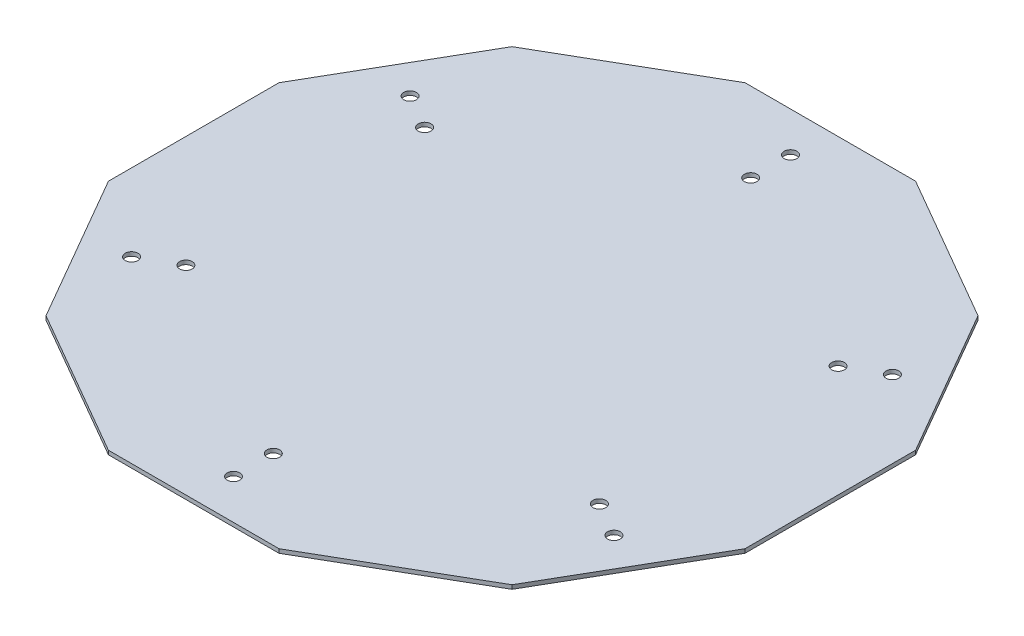
from build123d import *

# Parameters (mm, degrees)
EXTRUDE_2_DEPTH      = 1
SKETCH_9_R           = 1.6
CUT_EXTRUDE_5_DEPTH  = 1
SKETCH_10_R          = 1.6
CUT_EXTRUDE_6_DEPTH  = 1
SKETCH_11_R          = 1.6
CUT_EXTRUDE_7_DEPTH  = 1
SKETCH_12_R          = 1.6
CUT_EXTRUDE_8_DEPTH  = 1
SKETCH_16_R          = 1.6
CUT_EXTRUDE_9_DEPTH  = 1
SKETCH_17_R          = 1.6
CUT_EXTRUDE_10_DEPTH = 1
SKETCH_18_R          = 1.6
CUT_EXTRUDE_11_DEPTH = 1
SKETCH_19_R          = 1.6
CUT_EXTRUDE_12_DEPTH = 1
SKETCH_20_R          = 1.6
CUT_EXTRUDE_13_DEPTH = 1
SKETCH_21_R          = 1.6
CUT_EXTRUDE_14_DEPTH = 1
SKETCH_22_R          = 1.6
CUT_EXTRUDE_15_DEPTH = 1
SKETCH_23_R          = 1.6
CUT_EXTRUDE_16_DEPTH = 1


with BuildPart() as part:
    # ｽｹｯﾁ8 → ﾎﾞｽ - 押し出し2 (new body)
    with BuildSketch(Plane(origin=(0, 0, 0), x_dir=(1, 0, 0), z_dir=(0, 1, 0))):
        Polygon((-80, -21.435935394), (-58.564064606, -58.564064606), (-21.435935394, -80), (21.435935394, -80), (58.564064606, -58.564064606), (80, -21.435935394), (80, 21.435935394), (58.564064606, 58.564064606), (21.435935394, 80), (-21.435935394, 80), (-58.564064606, 58.564064606), (-80, 21.435935394), align=None)
    extrude(amount=EXTRUDE_2_DEPTH)

    # ｽｹｯﾁ9 → ｶｯﾄ - 押し出し5 (cut)
    with BuildSketch(Plane(origin=(0, 1, 0), x_dir=(1, 0, 0), z_dir=(0, 1, 0))):
        with Locations((-60.621778265, 35)):
            Circle(SKETCH_9_R)
    extrude(amount=-CUT_EXTRUDE_5_DEPTH, mode=Mode.SUBTRACT)

    # ｽｹｯﾁ10 → ｶｯﾄ - 押し出し6 (cut)
    with BuildSketch(Plane(origin=(0, 1, 0), x_dir=(1, 0, 0), z_dir=(0, 1, 0))):
        with Locations((-51.961524227, 30)):
            Circle(SKETCH_10_R)
    extrude(amount=-CUT_EXTRUDE_6_DEPTH, mode=Mode.SUBTRACT)

    # ｽｹｯﾁ11 → ｶｯﾄ - 押し出し7 (cut)
    with BuildSketch(Plane(origin=(0, 1, 0), x_dir=(1, 0, 0), z_dir=(0, 1, 0))):
        with Locations((60.621778265, -35)):
            Circle(SKETCH_11_R)
    extrude(amount=-CUT_EXTRUDE_7_DEPTH, mode=Mode.SUBTRACT)

    # ｽｹｯﾁ12 → ｶｯﾄ - 押し出し8 (cut)
    with BuildSketch(Plane(origin=(0, 1, 0), x_dir=(1, 0, 0), z_dir=(0, 1, 0))):
        with Locations((51.961524227, -30)):
            Circle(SKETCH_12_R)
    extrude(amount=-CUT_EXTRUDE_8_DEPTH, mode=Mode.SUBTRACT)

    # ｽｹｯﾁ16 → ｶｯﾄ - 押し出し9 (cut)
    with BuildSketch(Plane(origin=(0, 1, 0), x_dir=(1, 0, 0), z_dir=(0, 1, 0))):
        with Locations((60.621778265, 35)):
            Circle(SKETCH_16_R)
    extrude(amount=-CUT_EXTRUDE_9_DEPTH, mode=Mode.SUBTRACT)

    # ｽｹｯﾁ17 → ｶｯﾄ - 押し出し10 (cut)
    with BuildSketch(Plane(origin=(0, 1, 0), x_dir=(1, 0, 0), z_dir=(0, 1, 0))):
        with Locations((51.961524227, 30)):
            Circle(SKETCH_17_R)
    extrude(amount=-CUT_EXTRUDE_10_DEPTH, mode=Mode.SUBTRACT)

    # ｽｹｯﾁ18 → ｶｯﾄ - 押し出し11 (cut)
    with BuildSketch(Plane(origin=(0, 1, 0), x_dir=(1, 0, 0), z_dir=(0, 1, 0))):
        with Locations((-60.621778265, -35)):
            Circle(SKETCH_18_R)
    extrude(amount=-CUT_EXTRUDE_11_DEPTH, mode=Mode.SUBTRACT)

    # ｽｹｯﾁ19 → ｶｯﾄ - 押し出し12 (cut)
    with BuildSketch(Plane(origin=(0, 1, 0), x_dir=(1, 0, 0), z_dir=(0, 1, 0))):
        with Locations((-51.961524227, -30)):
            Circle(SKETCH_19_R)
    extrude(amount=-CUT_EXTRUDE_12_DEPTH, mode=Mode.SUBTRACT)

    # ｽｹｯﾁ20 → ｶｯﾄ - 押し出し13 (cut)
    with BuildSketch(Plane(origin=(0, 1, 0), x_dir=(1, 0, 0), z_dir=(0, 1, 0))):
        with Locations((0, 70)):
            Circle(SKETCH_20_R)
    extrude(amount=-CUT_EXTRUDE_13_DEPTH, mode=Mode.SUBTRACT)

    # ｽｹｯﾁ21 → ｶｯﾄ - 押し出し14 (cut)
    with BuildSketch(Plane(origin=(0, 1, 0), x_dir=(1, 0, 0), z_dir=(0, 1, 0))):
        with Locations((0, 60)):
            Circle(SKETCH_21_R)
    extrude(amount=-CUT_EXTRUDE_14_DEPTH, mode=Mode.SUBTRACT)

    # ｽｹｯﾁ22 → ｶｯﾄ - 押し出し15 (cut)
    with BuildSketch(Plane(origin=(0, 1, 0), x_dir=(1, 0, 0), z_dir=(0, 1, 0))):
        with Locations((0, -70)):
            Circle(SKETCH_22_R)
    extrude(amount=-CUT_EXTRUDE_15_DEPTH, mode=Mode.SUBTRACT)

    # ｽｹｯﾁ23 → ｶｯﾄ - 押し出し16 (cut)
    with BuildSketch(Plane(origin=(0, 1, 0), x_dir=(1, 0, 0), z_dir=(0, 1, 0))):
        with Locations((0, -60)):
            Circle(SKETCH_23_R)
    extrude(amount=-CUT_EXTRUDE_16_DEPTH, mode=Mode.SUBTRACT)


solid = part.part
